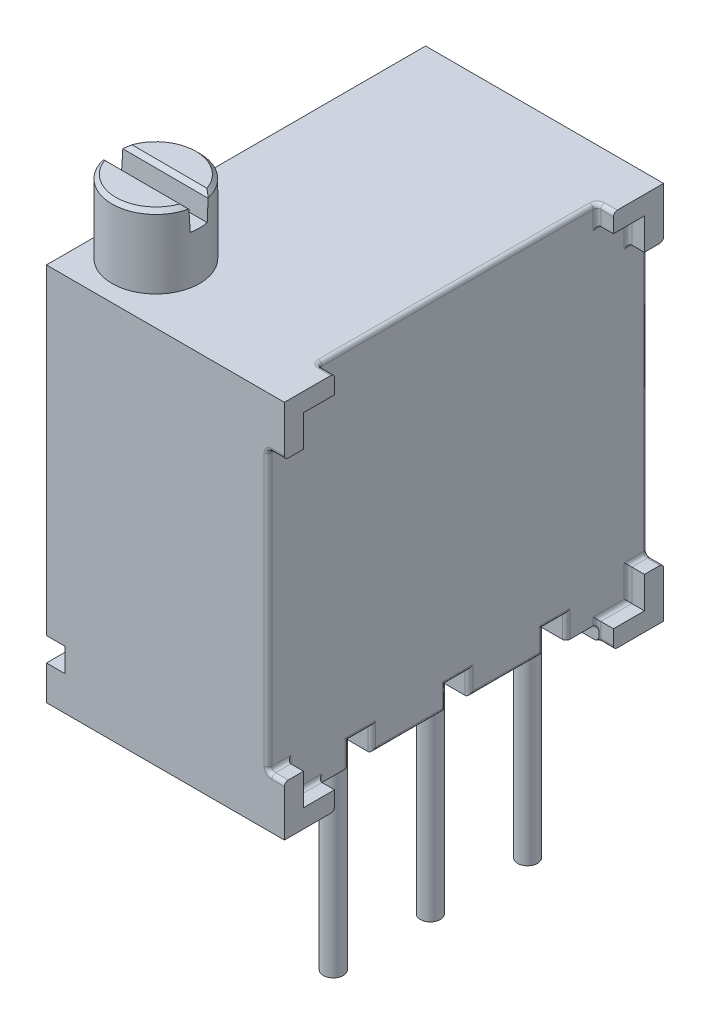
from build123d import *
from OCP.BRepFilletAPI import BRepFilletAPI_MakeChamfer

# Parameters (mm, degrees)
SKETCH1_W           = 6.22
SKETCH1_H           = 9.91
BOSS_EXTRUDE1_DEPTH = 9.91
CUT_EXTRUDE1_DEPTH  = 0.43
SKETCH3_W           = 0.489814652
SKETCH3_H           = 0.62
CUT_EXTRUDE2_DEPTH  = 15.355775841
SKETCH4_W           = 7.27
SKETCH4_H           = 0.383612798
CUT_EXTRUDE3_DEPTH  = 13.706239609
CUT_EXTRUDE4_DEPTH  = 0.6
SKETCH6_R           = 0.26
BOSS_EXTRUDE2_DEPTH = 5.7
SKETCH7_R           = 1.145
BOSS_EXTRUDE3_DEPTH = 1.9
CUT_EXTRUDE5_DEPTH  = 0.64
CUT_EXTRUDE5_DRAFT  = -3
CHAMFER1_SIZE       = 0.1
CHAMFER1_SIZE2      = 0.10567545
FILLET1_R           = 0.1
FILLET2_R           = 0.1
CUT_EXTRUDE6_DEPTH  = 0.1


with BuildPart() as part:
    # Sketch1 → Boss-Extrude1 (new body)
    with BuildSketch(Plane(origin=(0, 0, 0), x_dir=(1, 0, 0), z_dir=(0, 1, 0))):
        Rectangle(SKETCH1_W, SKETCH1_H)
    extrude(amount=BOSS_EXTRUDE1_DEPTH)

    # Sketch2 → Cut-Extrude1 (cut)
    with BuildSketch(Plane(origin=(3.11, 0, 0), x_dir=(0, 0, -1), z_dir=(1, 0, 0))):
        Polygon((-3.645, 9.91), (3.645, 9.91), (3.645, 9.425862487), (4.455, 9.425862487), (4.455, 8.6), (4.955, 8.6), (4.955, 1.31), (4.455, 1.31), (4.455, 0.484137513), (3.645, 0.484137513), (3.645, 0), (-3.645, 0), (-3.645, 0.484137513), (-4.455, 0.484137513), (-4.455, 1.31), (-4.955, 1.31), (-4.955, 8.6), (-4.455, 8.6), (-4.455, 9.425862487), (-3.645, 9.425862487), align=None)
    extrude(amount=-CUT_EXTRUDE1_DEPTH, mode=Mode.SUBTRACT)

    # Sketch3 → Cut-Extrude2 (cut, through all)
    with BuildSketch(Plane.XY.offset(4.955)):
        with Locations((-2.865092674, 1.21)):
            Rectangle(SKETCH3_W, SKETCH3_H)
    extrude(amount=-CUT_EXTRUDE2_DEPTH, mode=Mode.SUBTRACT)

    # Sketch4 → Cut-Extrude3 (cut, through all)
    with BuildSketch(Plane.ZY.offset(3.11)):
        with Locations((0, 0.191806399)):
            Rectangle(SKETCH4_W, SKETCH4_H)
    extrude(amount=-CUT_EXTRUDE3_DEPTH, mode=Mode.SUBTRACT)

    # Sketch5 → Cut-Extrude4 (cut)
    with BuildSketch(Plane.XZ.offset(-0.383612798)):
        with BuildLine():
            Line((2.95678105, -0.297817236), (2.006123314, -0.297817236))
            ThreePointArc((2.006123314, -0.297817236), (1.67, 0), (2.006123314, 0.297817236))
            Line((2.006123314, 0.297817236), (2.95678105, 0.297817236))
            Line((2.95678105, 0.297817236), (2.95678105, -0.297817236))
        make_face()
        with BuildLine():
            Line((2.95678105, 2.837817236), (2.95678105, 2.242182764))
            Line((2.95678105, 2.242182764), (2.006123314, 2.242182764))
            ThreePointArc((2.006123314, 2.242182764), (1.67, 2.54), (2.006123314, 2.837817236))
            Line((2.006123314, 2.837817236), (2.95678105, 2.837817236))
        make_face()
        with BuildLine():
            Line((2.95678105, -2.242182764), (2.95678105, -2.837817236))
            Line((2.95678105, -2.837817236), (2.006123314, -2.837817236))
            ThreePointArc((2.006123314, -2.837817236), (1.67, -2.54), (2.006123314, -2.242182764))
            Line((2.006123314, -2.242182764), (2.95678105, -2.242182764))
        make_face()
    extrude(amount=-CUT_EXTRUDE4_DEPTH, mode=Mode.SUBTRACT)

    # Sketch6 → Boss-Extrude2 (add)
    with BuildSketch(Plane.XZ.offset(-0.983612798)):
        with Locations(Location((1.97, 0, 0), (0, 0, 270))):
            Circle(SKETCH6_R)
        with Locations(Location((1.97, 2.536971659, 0), (0, 0, 270))):
            Circle(SKETCH6_R)
        with Locations(Location((1.97, -2.54, 0), (0, 0, 270))):
            Circle(SKETCH6_R)
    extrude(amount=BOSS_EXTRUDE2_DEPTH)

    # Sketch7 → Boss-Extrude3 (add)
    with BuildSketch(Plane(origin=(0, 9.91, 0), x_dir=(1, 0, 0), z_dir=(0, 1, 0))):
        with Locations(Location((-1.83, -3.375, 0), (0, 0, 90))):
            Circle(SKETCH7_R)
    extrude(amount=BOSS_EXTRUDE3_DEPTH)


with BuildPart() as cut_extrude5_tool:
    # Sketch8 → Cut-Extrude5 (with draft: the straight prism first)
    with BuildSketch(Plane(origin=(0, 11.81, 0), x_dir=(1, 0, 0), z_dir=(0, 1, 0))):
        Polygon((-3.294269163, -3.625814828), (-0.371005085, -3.634172177), (-0.369547047, -3.124174261), (-3.295956864, -3.115807919), align=None)
    extrude(amount=-CUT_EXTRUDE5_DEPTH)
    # Cut-Extrude5: the draft: its side faces are tilted about the plane it starts from
    cut_extrude5_sides = [cut_extrude5_tool.faces().sort_by_distance(p)[0] for p in [
        (-1.832637124, 11.49, 3.629993503),
        (-0.370276066, 11.49, 3.379173219),
        (-1.832751955, 11.49, 3.11999109),
        (-3.295113013, 11.49, 3.370811374),
    ]]
    draft(cut_extrude5_sides, Plane(origin=(0, 11.81, 0), x_dir=(1, 0, 0), z_dir=(0, 1, 0)), CUT_EXTRUDE5_DRAFT)


with BuildPart() as part_1:
    add(part.part)

    # Cut-Extrude5: cut by cut_extrude5_tool
    add(cut_extrude5_tool.part, mode=Mode.SUBTRACT)

    # Chamfer1: one chamfer whose edges measure the first distance from different faces: ONE call of the kernel's chamfer builder (chamfer() names one face for all edges)
    chamfer1_edges_1 = [part_1.edges().sort_by_distance(p)[0] for p in [
        (-1.114910793, 11.81, 2.480755947),
        (-1.833273439, 11.81, 4.519995321),
    ]]
    chamfer1_edges_2 = [part_1.edges().sort_by_distance(p)[0] for p in [
        (-1.829270981, 11.81, 3.120001042),
    ]]
    chamfer1_side_2 = [part_1.faces().sort_by_distance(p)[0] for p in [
        (-1.828209211, 11.81, 2.748611218),
    ]]
    chamfer1_edges_3 = [part_1.edges().sort_by_distance(p)[0] for p in [
        (-1.830729019, 11.81, 3.629998958),
    ]]
    chamfer1_side_3 = [part_1.faces().sort_by_distance(p)[0] for p in [
        (-1.831790789, 11.81, 4.001388782),
    ]]
    chamfer1 = BRepFilletAPI_MakeChamfer(part_1.part.solid().wrapped)
    for e in chamfer1_edges_1:
        chamfer1.Add(CHAMFER1_SIZE, e.wrapped)
    for e in chamfer1_edges_2:
        chamfer1.Add(CHAMFER1_SIZE, CHAMFER1_SIZE2, e.wrapped, chamfer1_side_2[0].wrapped)  # the first distance lies on this face
    for e in chamfer1_edges_3:
        chamfer1.Add(CHAMFER1_SIZE, CHAMFER1_SIZE2, e.wrapped, chamfer1_side_3[0].wrapped)  # the first distance lies on this face
    add(Compound.cast(chamfer1.Shape()), mode=Mode.REPLACE)

    # Fillet1
    fillet1_edges = [part_1.edges().sort_by_distance(p)[0] for p in [
        (-0.215, 0.383612798, -3.635),
        (-0.215, 0.383612798, 3.635),
    ]]
    fillet(fillet1_edges, radius=FILLET1_R)

    # Fillet2
    fillet2_edges = [part_1.edges().sort_by_distance(p)[0] for p in [
        (2.68, 0.242068757, 3.645),
        (2.68, 0.484137513, 4.05),
        (2.68, 0.897068757, 4.455),
        (2.68, 1.31, 4.705),
        (2.68, 8.6, 4.705),
        (2.68, 9.012931243, 4.455),
        (2.68, 9.425862487, 4.05),
        (2.68, 9.667931243, 3.645),
        (2.68, 9.667931243, -3.645),
        (2.68, 9.425862487, -4.05),
        (2.68, 9.012931243, -4.455),
        (2.68, 8.6, -4.705),
        (2.68, 1.31, -4.705),
        (2.68, 0.897068757, -4.455),
        (2.68, 0.484137513, -4.05),
        (2.68, 0.242068757, -3.645),
    ]]
    fillet(fillet2_edges, radius=FILLET2_R)
    fillet2_2_edges = [part_1.edges().sort_by_distance(p)[0] for p in [
        (2.945, 0, 3.645),
        (2.945, 0, -3.645),
        (2.68, 0.383612798, -1.27),
        (2.68, 0.683612798, -0.297817236),
        (2.68, 0.983612798, 0),
        (2.68, 0.683612798, 0.297817236),
        (2.68, 0.383612798, 1.27),
        (2.68, 0.683612798, 2.242182764),
        (2.68, 0.983612798, 2.54),
        (2.68, 0.683612798, 2.837817236),
        (2.68, 0.683612798, -2.837817236),
        (2.68, 0.983612798, -2.54),
        (2.68, 0.683612798, -2.242182764),
        (2.75763932, 0, -3.642467943),
        (2.75763932, 0, 3.642467943),
    ]]
    fillet(fillet2_2_edges, radius=FILLET2_R)
    fillet2_3_edges = [part_1.edges().sort_by_distance(p)[0] for p in [
        (2.945, 1.31, 4.955),
        (2.945, 8.6, 4.955),
        (2.945, 9.91, 3.645),
        (2.945, 9.91, -3.645),
        (2.945, 8.6, -4.955),
        (2.945, 1.31, -4.955),
        (2.68, 4.955, 4.955),
        (2.68, 9.91, 0),
        (2.68, 4.955, -4.955),
        (2.709289322, 8.570710678, -4.955),
        (2.709289322, 1.339289322, -4.955),
        (2.709289322, 9.91, 3.615710678),
        (2.709289322, 9.91, -3.615710678),
        (2.709289322, 1.339289322, 4.955),
        (2.709289322, 8.570710678, 4.955),
    ]]
    fillet(fillet2_3_edges, radius=FILLET2_R)

    # Sketch9 → Cut-Extrude6 (cut)
    with BuildSketch(Plane.ZY.offset(3.11)):
        with BuildLine():
            Line((2.724361764, 2.035815482), (2.596156635, 2.035815482))
            Line((2.596156635, 2.035815482), (2.596156635, 2.815062277))
            add(Edge.make_bspline(
                [(2.596156635, 2.815062277), (2.588774573, 2.807943186), (2.573431765, 2.793146935), (2.547496368, 2.772206545), (2.518549151, 2.750982573), (2.486966012, 2.73057335), (2.454772344, 2.711360269), (2.423661309, 2.694081055), (2.394152319, 2.679458648), (2.374714588, 2.671463058), (2.365387405, 2.66762638)],
                knots=[0, 0, 0, 0, 0.893362401, 1.856755847, 2.901947673, 4.020460078, 5.132200827, 6.168787962, 7.121294059, 8, 8, 8, 8], degree=3))
            Line((2.365387405, 2.66762638), (2.365387405, 2.785815482))
            add(Edge.make_bspline(
                [(2.365387405, 2.785815482), (2.381407805, 2.794066021), (2.412983067, 2.810327344), (2.457592084, 2.838412884), (2.499239399, 2.868858765), (2.537235586, 2.901658248), (2.571296746, 2.935185207), (2.600000581, 2.969015225), (2.624018123, 3.001908241), (2.636068179, 3.024847471), (2.641829712, 3.035815482)],
                knots=[0, 0, 0, 0, 1.141258006, 2.249351951, 3.335817539, 4.406819942, 5.426913362, 6.360259544, 7.215985427, 8, 8, 8, 8], degree=3))
            Line((2.641829712, 3.035815482), (2.724361764, 3.035815482))
            Line((2.724361764, 3.035815482), (2.724361764, 2.035815482))
        make_face()
        with BuildLine():
            Line((-0.15453704, 2.712995859), (-0.24428063, 2.712995859))
            add(Edge.make_bspline(
                [(-0.24428063, 2.712995859), (-0.243695729, 2.724901827), (-0.242547, 2.748284831), (-0.237167488, 2.782377376), (-0.229470095, 2.814964461), (-0.218586822, 2.845784437), (-0.205070743, 2.87510981), (-0.188862164, 2.902824101), (-0.169663921, 2.928821583), (-0.147890568, 2.952861253), (-0.124242385, 2.974914844), (-0.098726403, 2.993959199), (-0.071913538, 3.010049963), (-0.043885138, 3.023501746), (-0.014324977, 3.033598845), (0.016498697, 3.041090742), (0.048721307, 3.045598269), (0.070675599, 3.046082779), (0.081841165, 3.046329193)],
                knots=[0, 0, 0, 0, 1.10065271, 2.161652631, 3.183658789, 4.190468796, 5.17591951, 6.163126047, 7.15150782, 8.156236427, 9.156009102, 10.134482811, 11.092018607, 12.041330605, 13.001268258, 13.972401359, 14.968799086, 16, 16, 16, 16], degree=3))
            add(Edge.make_bspline(
                [(0.081841165, 3.046329193), (0.092806329, 3.046072491), (0.114352484, 3.045568081), (0.145798774, 3.041236358), (0.175735144, 3.034451903), (0.204103077, 3.024933213), (0.230676239, 3.012137662), (0.255654251, 2.996766937), (0.279334483, 2.978989842), (0.300650707, 2.958060181), (0.320224444, 2.935716643), (0.337110802, 2.911862956), (0.351571706, 2.887226017), (0.363625329, 2.86161796), (0.372498512, 2.834797666), (0.379235143, 2.807155608), (0.383042975, 2.778405662), (0.383627382, 2.758946646), (0.383924498, 2.749053552)],
                knots=[0, 0, 0, 0, 1.111607364, 2.184268762, 3.212621178, 4.221274766, 5.211760367, 6.196651075, 7.1921475, 8.207485113, 9.220403448, 10.201281604, 11.166441695, 12.114753415, 13.065576456, 14.026450734, 14.996634279, 16, 16, 16, 16], degree=3))
            add(Edge.make_bspline(
                [(0.383924498, 2.749053552), (0.383440709, 2.735125599), (0.38248162, 2.707514109), (0.374277512, 2.666938434), (0.361464223, 2.627626029), (0.346036407, 2.5959868), (0.330472852, 2.570491516), (0.316447849, 2.549500457), (0.300029332, 2.526898895), (0.280978333, 2.502762513), (0.259688941, 2.476902254), (0.235968322, 2.449333741), (0.209647328, 2.420341807), (0.19117347, 2.400540206), (0.18160078, 2.390279513)],
                knots=[0, 0, 0, 0, 1.184426356, 2.348067706, 3.509069118, 4.696110526, 5.333549288, 6.050745305, 6.844228056, 7.710549037, 8.667450064, 9.695053472, 10.805634456, 12, 12, 12, 12], degree=3))
            Line((0.18160078, 2.390279513), (-0.06859954, 2.12325227))
            Line((-0.06859954, 2.12325227), (0.396745011, 2.12325227))
            Line((0.396745011, 2.12325227), (0.396745011, 2.020688167))
            Line((0.396745011, 2.020688167), (-0.282742169, 2.020688167))
            Line((-0.282742169, 2.020688167), (0.105078344, 2.434550346))
            add(Edge.make_bspline(
                [(0.105078344, 2.434550346), (0.114520598, 2.444407005), (0.132657234, 2.46333963), (0.158309399, 2.490980476), (0.18134911, 2.516623202), (0.201925508, 2.540219359), (0.219592223, 2.562114092), (0.235270004, 2.581598293), (0.247831601, 2.599528136), (0.261464572, 2.620311169), (0.274668566, 2.645686117), (0.286014954, 2.676695742), (0.292933482, 2.708617814), (0.293763435, 2.730189825), (0.294180908, 2.741040731)],
                knots=[0, 0, 0, 0, 1.329631726, 2.553950428, 3.673215718, 4.687767853, 5.603093632, 6.413772471, 7.123043292, 7.734684054, 8.834405432, 9.900288307, 10.943827018, 12, 12, 12, 12], degree=3))
            add(Edge.make_bspline(
                [(0.294180908, 2.741040731), (0.293999268, 2.747863988), (0.293641289, 2.761311316), (0.290481947, 2.781027248), (0.285707516, 2.800045766), (0.278866014, 2.818425371), (0.269835517, 2.835981272), (0.258843123, 2.852734838), (0.246160247, 2.868931685), (0.231488456, 2.884118341), (0.215370879, 2.898027257), (0.198343951, 2.910348425), (0.180329635, 2.920645313), (0.161403886, 2.929086313), (0.141619466, 2.93570785), (0.12093811, 2.940296016), (0.099416963, 2.943176725), (0.084721678, 2.943566489), (0.077233793, 2.94376509)],
                knots=[0, 0, 0, 0, 0.991446411, 1.95395049, 2.89581595, 3.838931463, 4.798493298, 5.75982156, 6.748411868, 7.785213223, 8.824556874, 9.840280684, 10.836137867, 11.835679398, 12.848801643, 13.863922112, 14.911575587, 16, 16, 16, 16], degree=3))
            add(Edge.make_bspline(
                [(0.077233793, 2.94376509), (0.069413555, 2.943560795), (0.054055899, 2.943159594), (0.031507604, 2.940353118), (0.009997382, 2.935511449), (-0.010528876, 2.928889543), (-0.030105901, 2.920472814), (-0.048638485, 2.909989459), (-0.066085025, 2.897479889), (-0.082478317, 2.883296873), (-0.097582311, 2.86750613), (-0.110852847, 2.849903283), (-0.12244828, 2.830809736), (-0.132565203, 2.810277007), (-0.140781115, 2.788118784), (-0.147059158, 2.764413726), (-0.152026828, 2.73926476), (-0.153686406, 2.721897593), (-0.15453704, 2.712995859)],
                knots=[0, 0, 0, 0, 1.031018746, 2.02475058, 2.990194455, 3.934040569, 4.864654155, 5.795059489, 6.735614925, 7.690564532, 8.649604399, 9.611025574, 10.590972636, 11.591080095, 12.624614302, 13.701020113, 14.821632451, 16, 16, 16, 16], degree=3))
        make_face()
        with BuildLine():
            Line((-2.804917086, 2.765097089), (-2.894660676, 2.765097089))
            add(Edge.make_bspline(
                [(-2.894660676, 2.765097089), (-2.892229376, 2.775163513), (-2.887476383, 2.794842549), (-2.877562791, 2.822958909), (-2.866763003, 2.849565629), (-2.853794688, 2.874164508), (-2.839649329, 2.897249908), (-2.823442838, 2.91829823), (-2.805922917, 2.937844791), (-2.78654436, 2.955191431), (-2.766221885, 2.970899353), (-2.744669137, 2.984292227), (-2.722319738, 2.995813413), (-2.699018843, 3.005304908), (-2.67469708, 3.012455058), (-2.64957433, 3.017642716), (-2.623584759, 3.021011606), (-2.60594259, 3.021340396), (-2.596984394, 3.021507346)],
                knots=[0, 0, 0, 0, 1.162005537, 2.271625781, 3.343758855, 4.383309926, 5.390229558, 6.379919256, 7.361854164, 8.333198761, 9.295911338, 10.242430842, 11.177959212, 12.116337295, 13.062827104, 14.020064771, 14.994644689, 16, 16, 16, 16], degree=3))
            add(Edge.make_bspline(
                [(-2.596984394, 3.021507346), (-2.583932182, 3.02111328), (-2.558112465, 3.020333744), (-2.520180166, 3.013215334), (-2.483601074, 3.00195101), (-2.448775575, 2.986387088), (-2.416427451, 2.967190713), (-2.387645684, 2.944343645), (-2.362820395, 2.918286702), (-2.34199343, 2.889505969), (-2.325686287, 2.858747252), (-2.313661609, 2.827090065), (-2.306341129, 2.794609501), (-2.305392398, 2.77267885), (-2.304917086, 2.761691641)],
                knots=[0, 0, 0, 0, 1.083050992, 2.142477498, 3.193116406, 4.255571735, 5.30263384, 6.308962982, 7.297363603, 8.282367274, 9.249857812, 10.179914175, 11.08814088, 12, 12, 12, 12], degree=3))
            add(Edge.make_bspline(
                [(-2.304917086, 2.761691641), (-2.305249541, 2.751118271), (-2.305900103, 2.730427827), (-2.311424019, 2.700221685), (-2.320720094, 2.671752656), (-2.333597169, 2.644900895), (-2.350266183, 2.619836655), (-2.370458383, 2.596503544), (-2.394316286, 2.57479807), (-2.412395983, 2.562363935), (-2.421703945, 2.555962474)],
                knots=[0, 0, 0, 0, 1.024540389, 2.004866551, 2.965041327, 3.920577974, 4.882998113, 5.874504559, 6.905732034, 8, 8, 8, 8], degree=3))
            add(Edge.make_bspline(
                [(-2.421703945, 2.555962474), (-2.411066301, 2.550825853), (-2.389990052, 2.540648723), (-2.361261329, 2.520689935), (-2.335181936, 2.497645264), (-2.320638016, 2.479661649), (-2.313330548, 2.470625935)],
                knots=[0, 0, 0, 0, 1.015518401, 2.012035669, 3.001164323, 4, 4, 4, 4], degree=3))
            add(Edge.make_bspline(
                [(-2.313330548, 2.470625935), (-2.308518736, 2.464038006), (-2.298973908, 2.45097003), (-2.287192327, 2.429959623), (-2.276504009, 2.40871634), (-2.268175375, 2.386670796), (-2.261725699, 2.364078506), (-2.257115404, 2.340900679), (-2.254251364, 2.317118386), (-2.253841206, 2.301029106), (-2.253635035, 2.292941641)],
                knots=[0, 0, 0, 0, 1.025084078, 2.033381695, 3.024893161, 4.013698104, 4.991890475, 5.976764909, 6.982997093, 8, 8, 8, 8], degree=3))
            add(Edge.make_bspline(
                [(-2.253635035, 2.292941641), (-2.254147753, 2.278938863), (-2.255170777, 2.250999205), (-2.264314798, 2.209720714), (-2.27849001, 2.16937057), (-2.298620563, 2.130777759), (-2.323154137, 2.094669079), (-2.352341944, 2.062361562), (-2.385852346, 2.034590532), (-2.423225389, 2.01138761), (-2.463715997, 1.992839632), (-2.507023309, 1.979966077), (-2.552523324, 1.971581505), (-2.583725409, 1.9706824), (-2.599588561, 1.970225294)],
                knots=[0, 0, 0, 0, 0.955779014, 1.907060117, 2.875433937, 3.871313158, 4.872415639, 5.851225146, 6.836215519, 7.83643374, 8.849228613, 9.86973379, 10.916971861, 12, 12, 12, 12], degree=3))
            add(Edge.make_bspline(
                [(-2.599588561, 1.970225294), (-2.610279789, 1.970473355), (-2.631316562, 1.970961457), (-2.662243276, 1.9742982), (-2.691763762, 1.980392487), (-2.719917933, 1.988593431), (-2.7467308, 1.998991072), (-2.772120544, 2.011939271), (-2.796243371, 2.027171129), (-2.818871643, 2.04486644), (-2.840002662, 2.064661108), (-2.859074869, 2.08690654), (-2.876406239, 2.111191512), (-2.891532707, 2.1377981), (-2.905143265, 2.166382459), (-2.916337824, 2.197310601), (-2.926190843, 2.230306036), (-2.930771833, 2.253299676), (-2.933122215, 2.265097089)],
                knots=[0, 0, 0, 0, 1.048658725, 2.063410685, 3.046034179, 4.001477787, 4.936774919, 5.862367409, 6.792675028, 7.730719943, 8.675894397, 9.627829632, 10.600096036, 11.597688215, 12.626045268, 13.701542398, 14.82072376, 16, 16, 16, 16], degree=3))
            Line((-2.933122215, 2.265097089), (-2.843378625, 2.265097089))
            add(Edge.make_bspline(
                [(-2.843378625, 2.265097089), (-2.841040542, 2.257397371), (-2.836492767, 2.242420751), (-2.828751539, 2.220866378), (-2.819932032, 2.201106934), (-2.81047073, 2.182997471), (-2.800534031, 2.166359641), (-2.789415481, 2.151633393), (-2.777938582, 2.138171907), (-2.769287339, 2.130587732), (-2.765053304, 2.126875935)],
                knots=[0, 0, 0, 0, 1.198163088, 2.33053128, 3.407730985, 4.417276592, 5.372219308, 6.28897303, 7.162600585, 8, 8, 8, 8], degree=3))
            add(Edge.make_bspline(
                [(-2.765053304, 2.126875935), (-2.759454283, 2.122559269), (-2.748273522, 2.11393926), (-2.730054027, 2.102938794), (-2.710892631, 2.093407073), (-2.690374153, 2.086126017), (-2.668941361, 2.079960971), (-2.646247828, 2.075926537), (-2.622493766, 2.073158488), (-2.606274405, 2.072914222), (-2.597985997, 2.072789397)],
                knots=[0, 0, 0, 0, 0.946170439, 1.889420265, 2.845303464, 3.807233317, 4.801018734, 5.828864929, 6.890507805, 8, 8, 8, 8], degree=3))
            add(Edge.make_bspline(
                [(-2.597985997, 2.072789397), (-2.588627853, 2.07296537), (-2.570328811, 2.07330947), (-2.543627423, 2.076473957), (-2.518225295, 2.081082647), (-2.494404459, 2.088200642), (-2.471852885, 2.096995171), (-2.4508867, 2.108037573), (-2.431230669, 2.120993207), (-2.413136554, 2.135718681), (-2.396866409, 2.151839108), (-2.382540833, 2.168699986), (-2.370362359, 2.186230223), (-2.360538479, 2.204526829), (-2.352781179, 2.223514037), (-2.347500265, 2.243245131), (-2.343828403, 2.263558636), (-2.343529371, 2.277366913), (-2.343378625, 2.284327859)],
                knots=[0, 0, 0, 0, 1.217147791, 2.380027433, 3.494444702, 4.572153297, 5.609568379, 6.639424714, 7.649109417, 8.668170816, 9.669597737, 10.625200337, 11.543417969, 12.441394052, 13.322311151, 14.205496177, 15.095365482, 16, 16, 16, 16], degree=3))
            add(Edge.make_bspline(
                [(-2.343378625, 2.284327859), (-2.343815854, 2.293645384), (-2.344688136, 2.312234072), (-2.351347731, 2.33958195), (-2.362301692, 2.365931497), (-2.377636695, 2.390833151), (-2.396304046, 2.41391198), (-2.418122591, 2.434503832), (-2.443273513, 2.451495287), (-2.466422047, 2.463234903), (-2.486926378, 2.471245496), (-2.50447363, 2.4765812), (-2.524118374, 2.481099387), (-2.545623045, 2.485302893), (-2.569149679, 2.488880422), (-2.594672661, 2.491863797), (-2.622197164, 2.494250952), (-2.641251783, 2.495316979), (-2.651070933, 2.49586632)],
                knots=[0, 0, 0, 0, 1.07054697, 2.135767047, 3.216561865, 4.33974944, 5.486079747, 6.621378074, 7.775625952, 8.963672916, 9.598146892, 10.304877434, 11.070270905, 11.915000392, 12.823868403, 13.805723172, 14.86925407, 16, 16, 16, 16], degree=3))
            Line((-2.651070933, 2.49586632), (-2.651070933, 2.598430423))
            add(Edge.make_bspline(
                [(-2.651070933, 2.598430423), (-2.638699171, 2.598640367), (-2.614465929, 2.599051595), (-2.579067556, 2.604025312), (-2.545218039, 2.610905492), (-2.513667541, 2.621444118), (-2.484910766, 2.633684203), (-2.459962308, 2.647927691), (-2.439171694, 2.663760477), (-2.42263996, 2.681426937), (-2.410203037, 2.700374093), (-2.401109667, 2.72012171), (-2.395738145, 2.74084287), (-2.395021097, 2.754984204), (-2.394660676, 2.762092282)],
                knots=[0, 0, 0, 0, 1.321986639, 2.589447074, 3.816329219, 5.01088745, 6.139805852, 7.153945165, 8.075214402, 8.924034688, 9.728124013, 10.488707548, 11.240355623, 12, 12, 12, 12], degree=3))
            add(Edge.make_bspline(
                [(-2.394660676, 2.762092282), (-2.394779079, 2.767314495), (-2.395014637, 2.777703839), (-2.397985288, 2.79288243), (-2.402449299, 2.807596986), (-2.408586365, 2.821784932), (-2.416800707, 2.835347868), (-2.426630989, 2.848401424), (-2.438336161, 2.860871076), (-2.451749146, 2.872494024), (-2.466152518, 2.883570949), (-2.481938168, 2.892974845), (-2.498630133, 2.901016292), (-2.516246891, 2.907647578), (-2.534845614, 2.912635946), (-2.554338916, 2.916217615), (-2.574763969, 2.918456945), (-2.588698749, 2.918779349), (-2.595782471, 2.918943243)],
                knots=[0, 0, 0, 0, 0.884392785, 1.759457502, 2.611959086, 3.489218968, 4.37281399, 5.2945488, 6.255912374, 7.266815255, 8.301784654, 9.332968512, 10.37626691, 11.440494194, 12.520033166, 13.637162961, 14.798855837, 16, 16, 16, 16], degree=3))
            add(Edge.make_bspline(
                [(-2.595782471, 2.918943243), (-2.607168662, 2.918545711), (-2.629408541, 2.917769239), (-2.661469946, 2.910968378), (-2.69127547, 2.900117497), (-2.714057946, 2.887165205), (-2.730881539, 2.874379367), (-2.742903521, 2.863212971), (-2.754709381, 2.850803593), (-2.765522432, 2.836386914), (-2.776457853, 2.82093926), (-2.786413442, 2.803675351), (-2.79608764, 2.785045524), (-2.80191694, 2.771875343), (-2.804917086, 2.765097089)],
                knots=[0, 0, 0, 0, 1.472543308, 2.876219568, 4.221790263, 5.565193594, 6.249813518, 6.953379497, 7.687249741, 8.463570142, 9.283606569, 10.136032583, 11.040678096, 12, 12, 12, 12], degree=3))
        make_face()
    extrude(amount=-CUT_EXTRUDE6_DEPTH, mode=Mode.SUBTRACT)


solid = part_1.part
